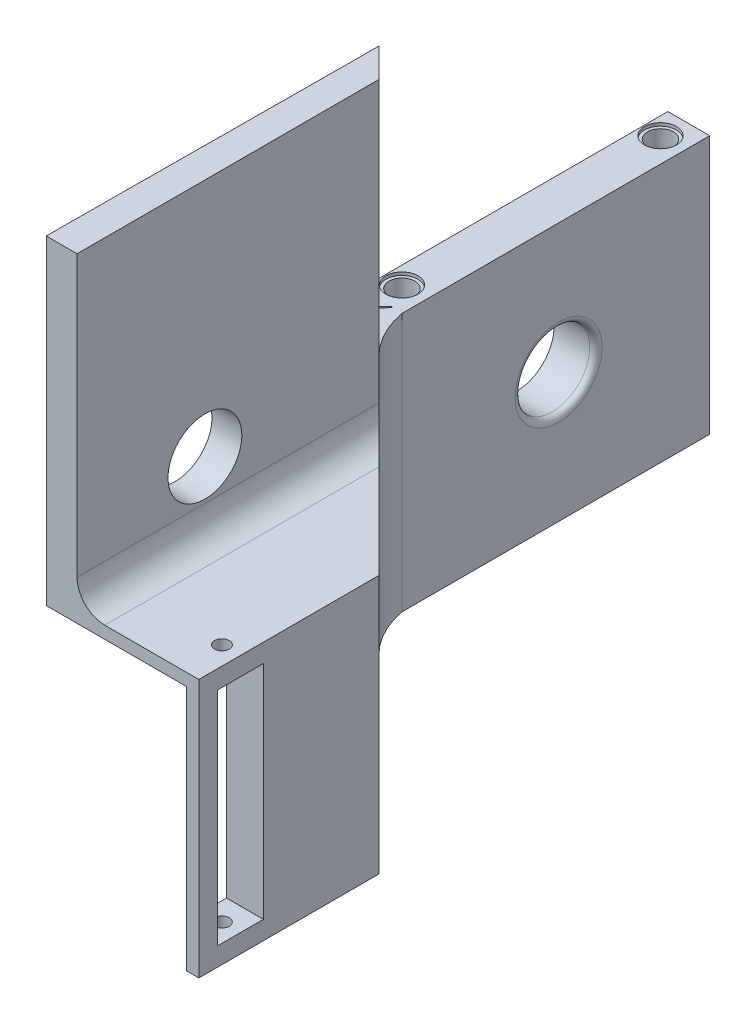
from build123d import *

# Parameters (mm, degrees)
SKETCH1_W           = 25
SKETCH1_H           = 50
SKETCH1_R           = 3.4
BOSS_EXTRUDE1_DEPTH = 3
SKETCH2_W           = 50
SKETCH2_H           = 3
BOSS_EXTRUDE2_DEPTH = 8
SKETCH3_W           = 8
SKETCH3_H           = 50
BOSS_EXTRUDE3_DEPTH = 42
SKETCH4_R           = 2.65
CUT_EXTRUDE1_DEPTH  = 0.5
SKETCH5_R           = 6.062177826
CUT_EXTRUDE2_DEPTH  = 9
FILLET2_R           = 1
SKETCH6_R           = 12.6
BOSS_EXTRUDE4_DEPTH = 2
FILLET4_R           = 1
SKETCH8_R           = 1.589780168
SKETCH8_R_2         = 1.777428262
CUT_EXTRUDE3_DEPTH  = 10
SKETCH9_W           = 49.021678163
SKETCH9_H           = 20.976854622
CUT_EXTRUDE4_DEPTH  = 68.79439129
SKETCH11_R          = 2.1
CUT_EXTRUDE5_DEPTH  = 59.480168703
SKETCH14_R          = 2.6
CUT_EXTRUDE6_DEPTH  = 0.5
BOSS_EXTRUDE5_DEPTH = 42
FILLET5_R           = 15
BOSS_EXTRUDE6_DEPTH = 42
SKETCH18_W          = 7.5
SKETCH18_H          = 36
CUT_EXTRUDE7_DEPTH  = 8
SKETCH19_R          = 1.2
CUT_EXTRUDE8_DEPTH  = 96.073366415
FILL_START          = -24.41711757
FILL_PATTERN1_DEPTH = 4.904046836
CHAMFER1_SIZE       = 4
CUT_EXTRUDE9_DEPTH  = 96.073366415
BOSS_EXTRUDE7_DEPTH = 2
BOSS_EXTRUDE8_DEPTH = 50
BOSS_EXTRUDE9_DEPTH = 4
FILLET7_R           = 4.5
SKETCH25_W          = 50
SKETCH25_H          = 42
CUT_EXTRUDE11_DEPTH = 1.2
SKETCH26_R          = 6
CUT_EXTRUDE12_DEPTH = 99.490393648


# Read off the part's stored shape, not the designer's step: Fill Pattern1
with BuildPart() as part:
    # Sketch1 → Boss-Extrude1 (new body)
    with BuildSketch(Plane(origin=(0, 0, 0), x_dir=(1, 0, 0), z_dir=(0, 1, 0))):
        with Locations((2.276951673, 11.384758364)):
            Rectangle(SKETCH1_W, SKETCH1_H)
        with Locations(Location((1.276951673, 11.384758364, 0), (0, 0, 270))):
            Circle(SKETCH1_R, mode=Mode.SUBTRACT)
    extrude(amount=BOSS_EXTRUDE1_DEPTH)

    # Sketch2 → Boss-Extrude2 (add)
    with BuildSketch(Plane.ZY.offset(10.223048327)):
        with Locations((-11.384758364, 1.5)):
            Rectangle(SKETCH2_W, SKETCH2_H)
    extrude(amount=BOSS_EXTRUDE2_DEPTH)

    # Sketch3 → Boss-Extrude3 (add)
    with BuildSketch(Plane.XZ):
        with Locations((-14.223048327, -11.384758364)):
            Rectangle(SKETCH3_W, SKETCH3_H)
    extrude(amount=BOSS_EXTRUDE3_DEPTH)

    # Sketch4 → Cut-Extrude1 (cut)
    with BuildSketch(Plane(origin=(0, 3, 0), x_dir=(1, 0, 0), z_dir=(0, 1, 0))):
        with Locations(Location((-14.223048327, 32.384758364, 0), (0, 0, 270))):
            Circle(SKETCH4_R)
        with Locations(Location((-14.223048327, -9.615241636, 0), (0, 0, 270))):
            Circle(SKETCH4_R)
    cut_extrude1 = extrude(amount=-CUT_EXTRUDE1_DEPTH, mode=Mode.SUBTRACT)

    # Mirror1: Cut-Extrude1 across plane
    add(cut_extrude1.mirror(Plane.ZX.offset(-19.5)), mode=Mode.SUBTRACT)

    # Sketch5 → Cut-Extrude2 (cut)
    with BuildSketch(Plane.ZY.offset(18.223048327)):
        with Locations((-11.836279124, -21)):
            Circle(SKETCH5_R)
    extrude(amount=-CUT_EXTRUDE2_DEPTH, mode=Mode.SUBTRACT)

    # Fillet2
    fillet2_edges = [part.edges().sort_by_distance(p)[0] for p in [
        (-10.223048327, -21, -17.89845695),
    ]]
    fillet(fillet2_edges, radius=FILLET2_R)

    # Mirror2: Cut-Extrude1 across plane
    add(cut_extrude1.mirror(Plane.ZY.offset(1.723048327)), mode=Mode.SUBTRACT)

    # Sketch6 → Boss-Extrude4 (add)
    with BuildSketch(Plane(origin=(0, 3, 0), x_dir=(1, 0, 0), z_dir=(0, 1, 0))):
        with BuildLine():
            Line((14.776951673, 5.825082115), (14.776951673, 16.944434614))
            ThreePointArc((14.776951673, 16.944434614), (-13.323048327, 11.384758364), (14.776951673, 5.825082115))
        make_face()
        with Locations(Location((1.276951673, 11.384758364, 0), (0, 0, 270))):
            Circle(SKETCH6_R, mode=Mode.SUBTRACT)
    extrude(amount=BOSS_EXTRUDE4_DEPTH)

    # Fillet4
    # the kernel refuses this fillet: 1 mm, written as the material it takes off along each edge
    with BuildSketch(Plane(origin=(14.776951673, 5, -3.325082115), x_dir=(0, -1, 0), z_dir=(0, 0, -1))) as fillet4_piece_1:
        with BuildLine():
            CenterArc((FILLET4_R, FILLET4_R), FILLET4_R, 180, 90)
            Line((0, FILLET4_R), (0, 0))
            Line((0, 0), (FILLET4_R, 0))
        make_face()
    extrude(amount=16.119352499, mode=Mode.SUBTRACT)

    # Sketch8 → Cut-Extrude3 (cut)
    with BuildSketch(Plane(origin=(0, 3, 0), x_dir=(1, 0, 0), z_dir=(0, 1, 0))):
        with Locations(Location((1.276951673, 19.884758364, 0), (0, 0, 270))):
            Circle(SKETCH8_R)
        with Locations(Location((1.276951673, 2.884758364, 0), (0, 0, 270))):
            Circle(SKETCH8_R_2)
    extrude(amount=-CUT_EXTRUDE3_DEPTH, mode=Mode.SUBTRACT)

    # Sketch9 → Cut-Extrude4 (cut, through all)
    with BuildSketch(Plane.XY.offset(13.615241636)):
        with Locations((-9.733887409, 10.488427311)):
            Rectangle(SKETCH9_W, SKETCH9_H)
    extrude(amount=-CUT_EXTRUDE4_DEPTH, mode=Mode.SUBTRACT)

    # Sketch11 → Cut-Extrude5 (cut, through all)
    with BuildSketch(Plane(origin=(0, 0, 0), x_dir=(1, 0, 0), z_dir=(0, 1, 0))):
        with Locations(Location((-14.223048327, 32.384758364, 0), (0, 0, 270))):
            Circle(SKETCH11_R)
    cut_extrude5 = extrude(amount=-CUT_EXTRUDE5_DEPTH, mode=Mode.SUBTRACT)

    # Mirror3: Cut-Extrude5 across plane
    add(cut_extrude5.mirror(Plane.XY.offset(-11.384758364)), mode=Mode.SUBTRACT)

    # Sketch14 → Cut-Extrude6 (cut)
    with BuildSketch(Plane(origin=(0, 0, 0), x_dir=(1, 0, 0), z_dir=(0, 1, 0))):
        with Locations(Location((-14.223048327, -9.615241636, 0), (0, 0, 270))):
            Circle(SKETCH14_R)
    cut_extrude6 = extrude(amount=-CUT_EXTRUDE6_DEPTH, mode=Mode.SUBTRACT)

    # Mirror4: Cut-Extrude6 across plane
    add(cut_extrude6.mirror(Plane.XY.offset(-11.384758364)), mode=Mode.SUBTRACT)

    # Sketch16 → Boss-Extrude5 (add)
    with BuildSketch(Plane(origin=(0, 0, 0), x_dir=(1, 0, 0), z_dir=(0, 1, 0))):
        Polygon((-18.223048327, -13.615241636), (24.776951673, -56.615241636), (24.776951673, -52.372600949), (-13.98040764, -13.615241636), align=None)
    extrude(amount=-BOSS_EXTRUDE5_DEPTH)

    # Fillet5
    # the kernel refuses this fillet: 15 mm, written as the material it adds along each edge
    with BuildSketch(Plane(origin=(-13.98040764, 0, 13.615241636), x_dir=(1, 0, 0), z_dir=(0, -1, 0))) as fillet5_piece_1:
        with BuildLine():
            CenterArc((18.512169169, -2.701034267), FILLET5_R, 135, 34.626223963)
            Line((7.905567451, 7.905567451), (0, 0))
            Line((0, 0), (3.757359313, 0))
        make_face()
    extrude(amount=42)

    # Sketch17 → Boss-Extrude6 (add)
    with BuildSketch(Plane(origin=(0, 0, 0), x_dir=(1, 0, 0), z_dir=(0, 1, 0))):
        Polygon((24.776951673, -56.615241636), (24.776951673, -81.615241636), (18.776951673, -81.615241636), (18.776951673, -50.615241636), align=None)
    extrude(amount=-BOSS_EXTRUDE6_DEPTH)

    # Sketch18 → Cut-Extrude7 (cut)
    with BuildSketch(Plane(origin=(24.776951673, 0, 0), x_dir=(0, 0, -1), z_dir=(1, 0, 0))):
        with Locations((-74.865241636, -21)):
            Rectangle(SKETCH18_W, SKETCH18_H)
    extrude(amount=-CUT_EXTRUDE7_DEPTH, mode=Mode.SUBTRACT)

    # Sketch19 → Cut-Extrude8 (cut, through all)
    with BuildSketch(Plane(origin=(0, 0, 0), x_dir=(1, 0, 0), z_dir=(0, 1, 0))):
        with Locations(Location((21.776951673, -74.865241636, 0), (0, 0, 270))):
            Circle(SKETCH19_R)
    extrude(amount=-CUT_EXTRUDE8_DEPTH, mode=Mode.SUBTRACT)

    # Fill Pattern1 outline → Fill Pattern1 (cut)
    with BuildSketch(Plane(origin=(0, 0, 0), x_dir=(0.7071067811865468, 0, 0.7071067811865482), z_dir=(0.7071067811865481, 0, -0.707106781186547)).offset(FILL_START)):
        Polygon((45.971737286, 5.859685187), (47.221737286, 3.694621678), (49.721737286, 3.694621678), (50.971737286, 5.859685187), (49.721737286, 8.024748697), (47.221737286, 8.024748697), align=None)
        Polygon((30.237460587, 33.11225185), (31.487460587, 30.947188341), (33.987460587, 30.947188341), (35.237460587, 33.11225185), (33.987460587, 35.27731536), (31.487460587, 35.27731536), align=None)
        Polygon((40.726978386, 14.943874075), (41.976978386, 12.778810565), (44.476978386, 12.778810565), (45.726978386, 14.943874075), (44.476978386, 17.108937584), (41.976978386, 17.108937584), align=None)
        Polygon((35.482219487, 24.028062963), (36.732219487, 21.862999453), (39.232219487, 21.862999453), (40.482219487, 24.028062963), (39.232219487, 26.193126472), (36.732219487, 26.193126472), align=None)
        Polygon((15.753183888, 3.694621678), (18.253183888, 3.694621678), (19.503183888, 5.859685187), (18.253183888, 8.024748697), (15.753183888, 8.024748697), (14.503183888, 5.859685187), align=None)
        Polygon((26.242701687, 3.694621678), (28.742701687, 3.694621678), (29.992701687, 5.859685187), (28.742701687, 8.024748697), (26.242701687, 8.024748697), (24.992701687, 5.859685187), align=None)
        Polygon((36.732219487, 3.694621678), (39.232219487, 3.694621678), (40.482219487, 5.859685187), (39.232219487, 8.024748697), (36.732219487, 8.024748697), (35.482219487, 5.859685187), align=None)
        Polygon((45.971737286, 11.915811112), (47.221737286, 9.750747603), (49.721737286, 9.750747603), (50.971737286, 11.915811112), (49.721737286, 14.080874622), (47.221737286, 14.080874622), align=None)
        Polygon((40.726978386, 21), (41.976978386, 18.834936491), (44.476978386, 18.834936491), (45.726978386, 21), (44.476978386, 23.165063509), (41.976978386, 23.165063509), align=None)
        Polygon((35.482219487, 30.084188888), (36.732219487, 27.919125378), (39.232219487, 27.919125378), (40.482219487, 30.084188888), (39.232219487, 32.249252397), (36.732219487, 32.249252397), align=None)
        Polygon((15.753183888, 9.750747603), (18.253183888, 9.750747603), (19.503183888, 11.915811112), (18.253183888, 14.080874622), (15.753183888, 14.080874622), (14.503183888, 11.915811112), align=None)
        Polygon((26.242701687, 9.750747603), (28.742701687, 9.750747603), (29.992701687, 11.915811112), (28.742701687, 14.080874622), (26.242701687, 14.080874622), (24.992701687, 11.915811112), align=None)
        Polygon((36.732219487, 9.750747603), (39.232219487, 9.750747603), (40.482219487, 11.915811112), (39.232219487, 14.080874622), (36.732219487, 14.080874622), (35.482219487, 11.915811112), align=None)
        Polygon((45.971737286, 17.971937037), (47.221737286, 15.806873528), (49.721737286, 15.806873528), (50.971737286, 17.971937037), (49.721737286, 20.137000547), (47.221737286, 20.137000547), align=None)
        Polygon((40.726978386, 27.056125925), (41.976978386, 24.891062416), (44.476978386, 24.891062416), (45.726978386, 27.056125925), (44.476978386, 29.221189435), (41.976978386, 29.221189435), align=None)
        Polygon((35.482219487, 36.140314813), (36.732219487, 33.975251303), (39.232219487, 33.975251303), (40.482219487, 36.140314813), (39.232219487, 38.305378322), (36.732219487, 38.305378322), align=None)
        Polygon((15.753183888, 15.806873528), (18.253183888, 15.806873528), (19.503183888, 17.971937037), (18.253183888, 20.137000547), (15.753183888, 20.137000547), (14.503183888, 17.971937037), align=None)
        Polygon((26.242701687, 15.806873528), (28.742701687, 15.806873528), (29.992701687, 17.971937037), (28.742701687, 20.137000547), (26.242701687, 20.137000547), (24.992701687, 17.971937037), align=None)
        Polygon((36.732219487, 15.806873528), (39.232219487, 15.806873528), (40.482219487, 17.971937037), (39.232219487, 20.137000547), (36.732219487, 20.137000547), (35.482219487, 17.971937037), align=None)
        Polygon((44.476978386, 6.72268464), (45.726978386, 8.88774815), (44.476978386, 11.052811659), (41.976978386, 11.052811659), (40.726978386, 8.88774815), (41.976978386, 6.72268464), align=None)
        Polygon((45.971737286, 24.028062963), (47.221737286, 21.862999453), (49.721737286, 21.862999453), (50.971737286, 24.028062963), (49.721737286, 26.193126472), (47.221737286, 26.193126472), align=None)
        Polygon((40.726978386, 33.11225185), (41.976978386, 30.947188341), (44.476978386, 30.947188341), (45.726978386, 33.11225185), (44.476978386, 35.27731536), (41.976978386, 35.27731536), align=None)
        Polygon((15.753183888, 21.862999453), (18.253183888, 21.862999453), (19.503183888, 24.028062963), (18.253183888, 26.193126472), (15.753183888, 26.193126472), (14.503183888, 24.028062963), align=None)
        Polygon((26.242701687, 21.862999453), (28.742701687, 21.862999453), (29.992701687, 24.028062963), (28.742701687, 26.193126472), (26.242701687, 26.193126472), (24.992701687, 24.028062963), align=None)
        Polygon((45.971737286, 36.140314813), (47.221737286, 33.975251303), (49.721737286, 33.975251303), (50.971737286, 36.140314813), (49.721737286, 38.305378322), (47.221737286, 38.305378322), align=None)
        Polygon((15.753183888, 33.975251303), (18.253183888, 33.975251303), (19.503183888, 36.140314813), (18.253183888, 38.305378322), (15.753183888, 38.305378322), (14.503183888, 36.140314813), align=None)
        Polygon((26.242701687, 33.975251303), (28.742701687, 33.975251303), (29.992701687, 36.140314813), (28.742701687, 38.305378322), (26.242701687, 38.305378322), (24.992701687, 36.140314813), align=None)
        Polygon((33.987460587, 6.72268464), (35.237460587, 8.88774815), (33.987460587, 11.052811659), (31.487460587, 11.052811659), (30.237460587, 8.88774815), (31.487460587, 6.72268464), align=None)
        Polygon((45.971737286, 30.084188888), (47.221737286, 27.919125378), (49.721737286, 27.919125378), (50.971737286, 30.084188888), (49.721737286, 32.249252397), (47.221737286, 32.249252397), align=None)
        Polygon((15.753183888, 27.919125378), (18.253183888, 27.919125378), (19.503183888, 30.084188888), (18.253183888, 32.249252397), (15.753183888, 32.249252397), (14.503183888, 30.084188888), align=None)
        Polygon((26.242701687, 27.919125378), (28.742701687, 27.919125378), (29.992701687, 30.084188888), (28.742701687, 32.249252397), (26.242701687, 32.249252397), (24.992701687, 30.084188888), align=None)
        Polygon((19.747942788, 27.056125925), (20.997942788, 24.891062416), (23.497942788, 24.891062416), (24.747942788, 27.056125925), (23.497942788, 29.221189435), (20.997942788, 29.221189435), align=None)
        Polygon((19.747942788, 8.88774815), (20.997942788, 6.72268464), (23.497942788, 6.72268464), (24.747942788, 8.88774815), (23.497942788, 11.052811659), (20.997942788, 11.052811659), align=None)
        Polygon((33.987460587, 24.891062416), (35.237460587, 27.056125925), (33.987460587, 29.221189435), (31.487460587, 29.221189435), (30.237460587, 27.056125925), (31.487460587, 24.891062416), align=None)
        Polygon((19.747942788, 14.943874075), (20.997942788, 12.778810565), (23.497942788, 12.778810565), (24.747942788, 14.943874075), (23.497942788, 17.108937584), (20.997942788, 17.108937584), align=None)
        Polygon((31.487460587, 12.778810565), (33.987460587, 12.778810565), (35.237460587, 14.943874075), (33.987460587, 17.108937584), (31.487460587, 17.108937584), (30.237460587, 14.943874075), align=None)
        Polygon((19.747942788, 21), (20.997942788, 18.834936491), (23.497942788, 18.834936491), (24.747942788, 21), (23.497942788, 23.165063509), (20.997942788, 23.165063509), align=None)
        Polygon((31.487460587, 18.834936491), (33.987460587, 18.834936491), (35.237460587, 21), (33.987460587, 23.165063509), (31.487460587, 23.165063509), (30.237460587, 21), align=None)
        Polygon((20.997942788, 30.947188341), (23.497942788, 30.947188341), (24.747942788, 33.11225185), (23.497942788, 35.27731536), (20.997942788, 35.27731536), (19.747942788, 33.11225185), align=None)
    extrude(amount=FILL_PATTERN1_DEPTH, mode=Mode.SUBTRACT)

    # Chamfer1
    # the kernel refuses this chamfer: 4 mm, written as the material it takes off along each edge
    with BuildSketch(Plane(origin=(18.776951673, 10.286731952, 81.615241636), x_dir=(0.9996219169112968, 0, 0.027495876610585623), z_dir=(0, -1, 0))) as chamfer1_piece_1:
        Polygon((CHAMFER1_SIZE * 0.999621916911, -CHAMFER1_SIZE * 0.0274958766106), (-CHAMFER1_SIZE * 0.0274958766106, -CHAMFER1_SIZE * 0.999621916911), (0, 0), align=None)
    extrude(amount=62.573463904, mode=Mode.SUBTRACT)

    # Sketch20 → Cut-Extrude9 (cut, through all)
    with BuildSketch(Plane(origin=(0, 0, 0), x_dir=(1, 0, 0), z_dir=(0, 1, 0))):
        Polygon((-12.007369699, -13.422049918), (-13.646299524, -15.19356362), (-10.796749548, -17.829847178), (-10.525107778, -17.536230508), (-13.131913788, -15.124523438), (-11.876337797, -13.615241636), align=None)
    extrude(amount=-CUT_EXTRUDE9_DEPTH, mode=Mode.SUBTRACT)

    # Sketch21 → Boss-Extrude7 (add)
    with BuildSketch(Plane(origin=(0, 0, 0), x_dir=(1, 0, 0), z_dir=(0, 1, 0))):
        Polygon((18.776951673, -77.615241636), (0, -77.615241636), (0.276951673, -32.115241636), (18.776951673, -50.615241636), align=None)
    extrude(amount=-BOSS_EXTRUDE7_DEPTH)

    # Sketch22 → Boss-Extrude8 (add)
    with BuildSketch(Plane(origin=(0, 0, 0), x_dir=(1, 0, 0), z_dir=(0, 1, 0))):
        Polygon((0, -77.615241636), (0.276951673, -32.115241636), (0.276951673, -27.872600949), (5, -32.595649276), (5, -77.615241636), align=None)
    extrude(amount=BOSS_EXTRUDE8_DEPTH)

    # Sketch23 → Boss-Extrude9 (add)
    with BuildSketch(Plane.XY.offset(81.615241636)):
        Polygon((22.776951673, 0), (5, 0), (5, 50), (0, 50), (0, -2), (22.776951673, -2), align=None)
    extrude(amount=-BOSS_EXTRUDE9_DEPTH)

    # Fillet7
    fillet7_edges = [part.edges().sort_by_distance(p)[0] for p in [
        (5, 0, 57.105445456),
    ]]
    fillet(fillet7_edges, radius=FILLET7_R)

    # Sketch25 → Cut-Extrude11 (cut)
    with BuildSketch(Plane.ZY.offset(18.223048327)):
        with Locations((-11.384758364, -21)):
            Rectangle(SKETCH25_W, SKETCH25_H)
    extrude(amount=-CUT_EXTRUDE11_DEPTH, mode=Mode.SUBTRACT)

    # Sketch26 → Cut-Extrude12 (cut, through all)
    with BuildSketch(Plane(origin=(5, 0, 0), x_dir=(0, 0, -1), z_dir=(1, 0, 0))):
        with Locations((-60.844089267, 11.093142253)):
            Circle(SKETCH26_R)
    extrude(amount=-CUT_EXTRUDE12_DEPTH, mode=Mode.SUBTRACT)


solid = part.part
